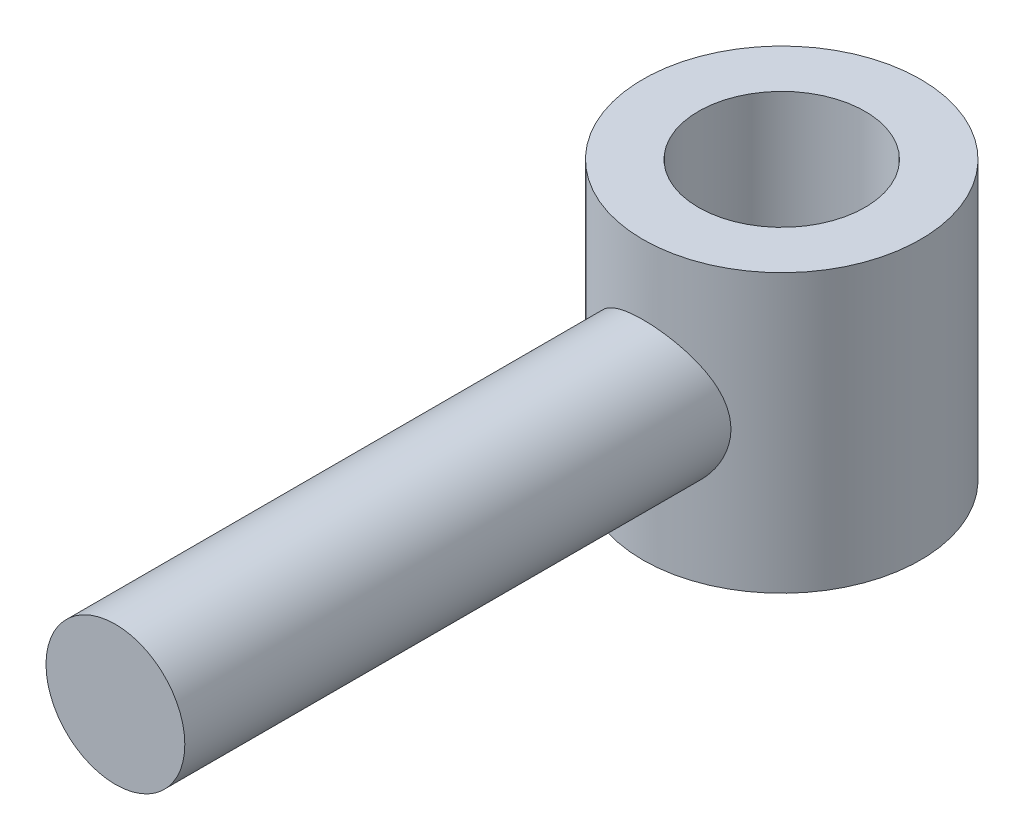
from build123d import *

# Parameters (mm, degrees)
SKETCH2_R               = 6.25
BOSS_EXTRUDE3_DEPTH     = 60
SKETCH1_R               = 12.5
BOSS_EXTRUDE4_DEPTH     = 12.5
CUT_EXTRUDE1_DEPTH      = 63.549980152
CUT_EXTRUDE1_DEPTH_BACK = 63.549980152
SKETCH1_4_R             = 7.5


with BuildPart() as part:
    # Sketch2 → Boss-Extrude3 (new body)
    with BuildSketch(Plane.XY):
        Circle(SKETCH2_R)
    extrude(amount=BOSS_EXTRUDE3_DEPTH)

    # Sketch1 → Boss-Extrude4 (add, symmetric)
    with BuildSketch(Plane(origin=(0, 0, 0), x_dir=(1, 0, 0), z_dir=(0, 1, 0))):
        Circle(SKETCH1_R)
    extrude(amount=BOSS_EXTRUDE4_DEPTH, both=True)

    # Sketch1<4> → Cut-Extrude1 (cut, two sides: drawn at the far end of the back side and taken through both)
    with BuildSketch(Plane(origin=(0, 0, 0), x_dir=(1, 0, 0), z_dir=(0, 1, 0)).offset(-CUT_EXTRUDE1_DEPTH_BACK)):
        Circle(SKETCH1_4_R)
    extrude(amount=CUT_EXTRUDE1_DEPTH + CUT_EXTRUDE1_DEPTH_BACK, mode=Mode.SUBTRACT)


solid = part.part
